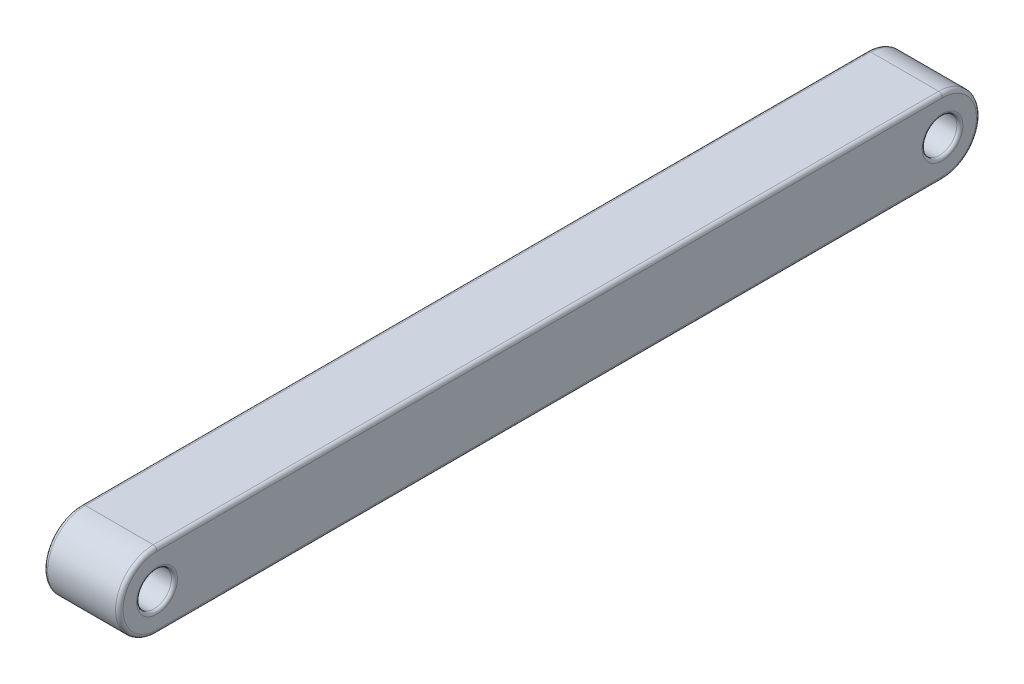
from build123d import *

# Parameters (mm, degrees)
SKETCH1_R           = 0.575
BOSS_EXTRUDE1_DEPTH = 2.5
FILLET1_R           = 0.125
FILLET2_R           = 0.1


with BuildPart() as part:
    # Sketch1 → Boss-Extrude1 (new body)
    with BuildSketch(Plane(origin=(0, 0, 0), x_dir=(0, 0, -1), z_dir=(1, 0, 0))):
        with BuildLine():
            Line((24, 0), (0, 0))
            Line((0, 0), (-1, 0))
            ThreePointArc((-1, 0), (-2.25, -1.25), (-1, -2.5))
            Line((-1, -2.5), (0, -2.5))
            Line((0, -2.5), (24, -2.5))
            Line((24, -2.5), (25, -2.5))
            ThreePointArc((25, -2.5), (26.25, -1.25), (25, 0))
            Line((25, 0), (24, 0))
        make_face()
        with Locations((-1, -1.25)):
            Circle(SKETCH1_R, mode=Mode.SUBTRACT)
        with Locations((25, -1.25)):
            Circle(SKETCH1_R, mode=Mode.SUBTRACT)
    extrude(amount=BOSS_EXTRUDE1_DEPTH)

    # Fillet1
    fillet1_edges = [part.edges().sort_by_distance(p)[0] for p in [
        (2.5, -1.25, -26.25),
        (2.5, 0, -12),
        (2.5, -1.25, 2.25),
        (0, -1.25, -26.25),
        (0, 0, -12),
        (0, -1.25, 2.25),
        (2.5, -2.5, -12),
        (0, -2.5, -12),
    ]]
    fillet(fillet1_edges, radius=FILLET1_R)

    # Fillet2
    fillet2_edges = [part.edges().sort_by_distance(p)[0] for p in [
        (0, -1.25, -24.425),
        (2.5, -1.25, -24.425),
        (0, -1.25, 1.575),
        (2.5, -1.25, 1.575),
    ]]
    fillet(fillet2_edges, radius=FILLET2_R)


solid = part.part
